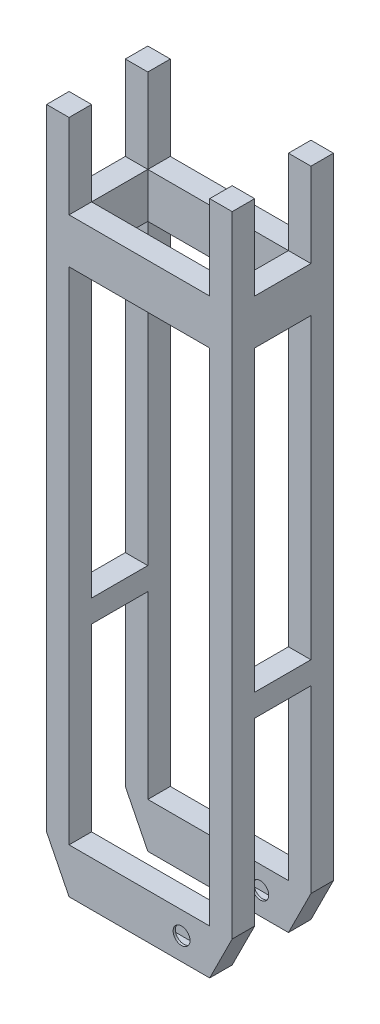
from build123d import *

# Parameters (mm, degrees)
ESQUISSE1_W                  = 250
ESQUISSE1_H                  = 890
BOSS_EXTRU_1_DEPTH           = 180
ESQUISSE2_W                  = 250
ESQUISSE2_H                  = 100
ENL_V_MAT_EXTRU_1_DEPTH      = 1258.497514908
ENL_V_MAT_EXTRU_2_DEPTH      = 1325.726386844
ENL_V_MAT_EXTRU_2_DEPTH_BACK = 1325.726386844
ESQUISSE3_W                  = 100
ESQUISSE3_H                  = 230
ESQUISSE3_H_2                = 970
BOSS_EXTRU_2_REACH           = 1331.248
ESQUISSE6_W                  = 40
ESQUISSE6_H                  = 40
COQUE1_START                 = 4
COQUE1_OUTLINE_W             = 258
COQUE1_OUTLINE_H             = 898
COQUE1_DEPTH                 = 32
COQUE1_START_2               = 144
COQUE1_2_OUTLINE_W           = 258
COQUE1_2_OUTLINE_H           = 898
COQUE1_2_DEPTH               = 32
COQUE1_START_3               = 36
COQUE1_3_OUTLINE_W           = 32
COQUE1_3_OUTLINE_H           = 72
COQUE1_3_OUTLINE_H_2         = 32
COQUE1_3_DEPTH               = 108
ESQUISSE8_R                  = 15
ENL_V_MAT_EXTRU_5_DEPTH      = 1335.053971922


# Read off the part's stored shape, not the designer's step: Coque1
with BuildPart() as part:
    # Esquisse1 → Boss.-Extru.1 (new body)
    with BuildSketch(Plane.XY):
        Polygon((0, -80), (0, -1200), (40, -1280), (290, -1280), (330, -1200), (330, -80), (290, -80), (290, -230), (40, -230), (40, -80), align=None)
        with Locations((165, -755)):
            Rectangle(ESQUISSE1_W, ESQUISSE1_H, mode=Mode.SUBTRACT)
    extrude(amount=BOSS_EXTRU_1_DEPTH)

    # Esquisse2 → Enlèv. mat.-Extru.1 (cut, through all)
    with BuildSketch(Plane(origin=(0, -80, 0), x_dir=(1, 0, 0), z_dir=(0, 1, 0))):
        with Locations((165, -90)):
            Rectangle(ESQUISSE2_W, ESQUISSE2_H)
    extrude(amount=-ENL_V_MAT_EXTRU_1_DEPTH, mode=Mode.SUBTRACT)

    # Esquisse3 → Enlèv. mat.-Extru.2 (cut, two sides: drawn at the far end of the back side and taken through both)
    with BuildSketch(Plane.ZY.offset(-290).offset(-ENL_V_MAT_EXTRU_2_DEPTH_BACK)):
        with Locations((90, -115)):
            Rectangle(ESQUISSE3_W, ESQUISSE3_H)
        with Locations((90, -795)):
            Rectangle(ESQUISSE3_W, ESQUISSE3_H_2)
    extrude(amount=ENL_V_MAT_EXTRU_2_DEPTH + ENL_V_MAT_EXTRU_2_DEPTH_BACK, mode=Mode.SUBTRACT)

    # Esquisse6 → Boss.-Extru.2 (add, up to next)
    with BuildSketch(Plane(origin=(0, 0, 140), x_dir=(-1, 0, 0), z_dir=(0, 0, -1)), mode=Mode.PRIVATE) as boss_extru_2_sk1:
        with Locations((-310, -860)):
            Rectangle(ESQUISSE6_W, ESQUISSE6_H)
    boss_extru_2_tool1 = extrude(boss_extru_2_sk1.sketch, amount=BOSS_EXTRU_2_REACH, mode=Mode.PRIVATE) - part.part
    # Esquisse6 → Boss.-Extru.2 (add, up to next)
    with BuildSketch(Plane(origin=(0, 0, 140), x_dir=(-1, 0, 0), z_dir=(0, 0, -1)), mode=Mode.PRIVATE) as boss_extru_2_sk2:
        with Locations((-20, -860)):
            Rectangle(ESQUISSE6_W, ESQUISSE6_H)
    boss_extru_2_tool2 = extrude(boss_extru_2_sk2.sketch, amount=BOSS_EXTRU_2_REACH, mode=Mode.PRIVATE) - part.part
    add(boss_extru_2_tool1.solids().sort_by_distance((310, -860, 140))[0])
    add(boss_extru_2_tool2.solids().sort_by_distance((20, -860, 140))[0])

    # Coque1 outline → Coque1 (cut)
    with BuildSketch(Plane.XY.offset(COQUE1_START)):
        Polygon((294, -234), (36, -234), (36, -84), (4, -84), (4, -1199.05572809), (42.472135955, -1276), (287.527864045, -1276), (326, -1199.05572809), (326, -84), (294, -84), align=None)
        with Locations((165, -755)):
            Rectangle(COQUE1_OUTLINE_W, COQUE1_OUTLINE_H, mode=Mode.SUBTRACT)
    extrude(amount=COQUE1_DEPTH, mode=Mode.SUBTRACT)

    # Coque1 2 outline → Coque1 2 (cut)
    with BuildSketch(Plane.XY.offset(COQUE1_START_2)):
        Polygon((294, -234), (36, -234), (36, -84), (4, -84), (4, -1199.05572809), (42.472135955, -1276), (287.527864045, -1276), (326, -1199.05572809), (326, -84), (294, -84), align=None)
        with Locations((165, -755)):
            Rectangle(COQUE1_2_OUTLINE_W, COQUE1_2_OUTLINE_H, mode=Mode.SUBTRACT)
    extrude(amount=COQUE1_2_DEPTH, mode=Mode.SUBTRACT)

    # Coque1 3 outline → Coque1 3 (cut)
    with BuildSketch(Plane.XY.offset(COQUE1_START_3)):
        with Locations((310, -270)):
            Rectangle(COQUE1_3_OUTLINE_W, COQUE1_3_OUTLINE_H)
        with Locations((310, -860)):
            Rectangle(COQUE1_3_OUTLINE_W, COQUE1_3_OUTLINE_H_2)
        with Locations((20, -270)):
            Rectangle(COQUE1_3_OUTLINE_W, COQUE1_3_OUTLINE_H)
        with Locations((20, -860)):
            Rectangle(COQUE1_3_OUTLINE_W, COQUE1_3_OUTLINE_H_2)
    extrude(amount=COQUE1_3_DEPTH, mode=Mode.SUBTRACT)

    # Esquisse8 → Enlèv. mat.-Extru.5 (cut, through all)
    with BuildSketch(Plane(origin=(0, 0, 0), x_dir=(-1, 0, 0), z_dir=(0, 0, -1))):
        with Locations((-240, -1240)):
            Circle(ESQUISSE8_R)
    extrude(amount=-ENL_V_MAT_EXTRU_5_DEPTH, mode=Mode.SUBTRACT)


solid = part.part
